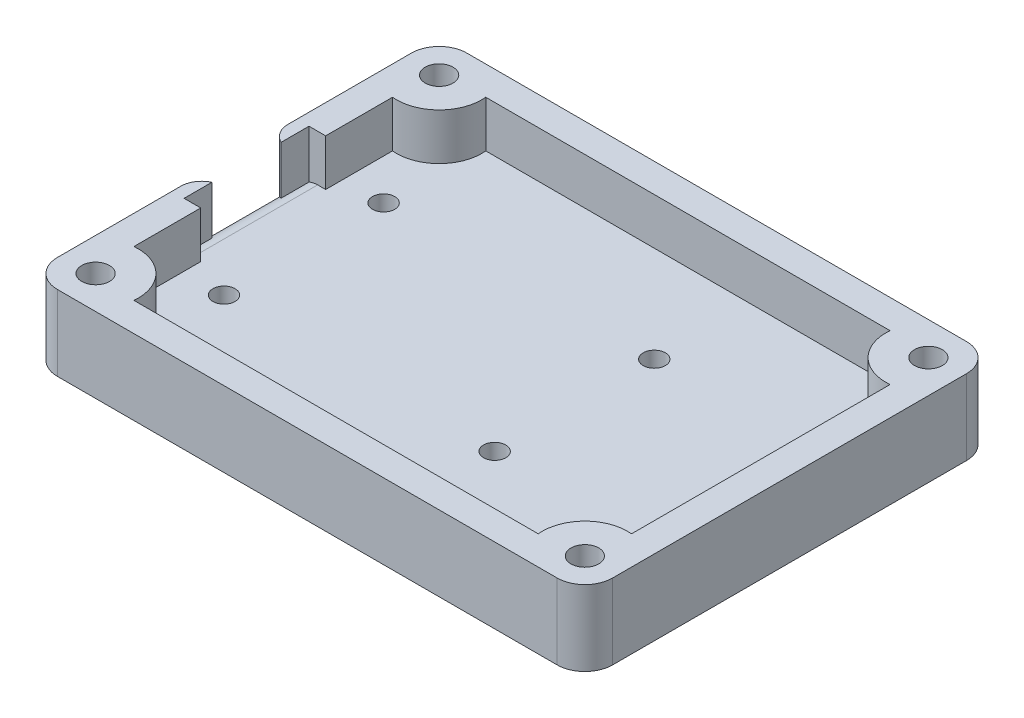
from build123d import *

# Parameters (mm, degrees)
SKETCH1_W           = 80
SKETCH1_H           = 59
BOSS_EXTRUDE1_DEPTH = 10.85
SKETCH2_R           = 2
CUT_EXTRUDE1_DEPTH  = 8.85
SHELL3_START        = 4.15
SHELL3_DEPTH        = 6.7
SKETCH3_R           = 1.6
CUT_EXTRUDE2_DEPTH  = 8.85
SKETCH4_W           = 10
SKETCH4_H           = 6.7
CUT_EXTRUDE3_DEPTH  = 8.85
SKETCH5_W           = 2.4
SKETCH5_H           = 18
CUT_EXTRUDE4_DEPTH  = 6.7
FILLET1_R           = 4
FILLET2_R           = 3


# Read off the part's stored shape, not the designer's step: Shell3
with BuildPart() as part:
    # Sketch1 → Boss-Extrude1 (new body)
    with BuildSketch(Plane(origin=(0, 0, 0), x_dir=(1, 0, 0), z_dir=(0, 1, 0))):
        Rectangle(SKETCH1_W, SKETCH1_H)
    extrude(amount=BOSS_EXTRUDE1_DEPTH)

    # Sketch2 → Cut-Extrude1 (cut)
    with BuildSketch(Plane(origin=(0, 10.85, 0), x_dir=(1, 0, 0), z_dir=(0, 1, 0))):
        with Locations(Location((-35.25, 24.75, 0), (0, 0, 270))):
            Circle(SKETCH2_R)
        with Locations(Location((-35.25, -24.75, 0), (0, 0, 270))):
            Circle(SKETCH2_R)
        with Locations(Location((35.25, 24.75, 0), (0, 0, 270))):
            Circle(SKETCH2_R)
        with Locations(Location((35.25, -24.75, 0), (0, 0, 270))):
            Circle(SKETCH2_R)
    extrude(amount=-CUT_EXTRUDE1_DEPTH, mode=Mode.SUBTRACT)

    # Shell3 outline → Shell3 (cut)
    with BuildSketch(Plane(origin=(0, 0, 0), x_dir=(1, 0, 0), z_dir=(0, 1, 0)).offset(SHELL3_START)):
        with BuildLine():
            ThreePointArc((-35.85, -18.629338271), (-30.901293296, -20.401293296), (-29.129338271, -25.35))
            Line((-29.129338271, -25.35), (29.129338271, -25.35))
            ThreePointArc((29.129338271, -25.35), (30.901293296, -20.401293296), (35.85, -18.629338271))
            Line((35.85, -18.629338271), (35.85, 18.629338271))
            ThreePointArc((35.85, 18.629338271), (30.901293296, 20.401293296), (29.129338271, 25.35))
            Line((29.129338271, 25.35), (-29.129338271, 25.35))
            ThreePointArc((-29.129338271, 25.35), (-30.901293296, 20.401293296), (-35.85, 18.629338271))
            Line((-35.85, 18.629338271), (-35.85, -18.629338271))
        make_face()
    extrude(amount=SHELL3_DEPTH, mode=Mode.SUBTRACT)

    # Sketch3 → Cut-Extrude2 (cut)
    with BuildSketch(Plane(origin=(0, 4.15, 0), x_dir=(1, 0, 0), z_dir=(0, 1, 0))):
        with Locations(Location((-30, -11.5, 0), (0, 0, 270))):
            Circle(SKETCH3_R)
        with Locations(Location((9, -11.5, 0), (0, 0, 270))):
            Circle(SKETCH3_R)
        with Locations(Location((9, 11.5, 0), (0, 0, 270))):
            Circle(SKETCH3_R)
        with Locations(Location((-30, 11.5, 0), (0, 0, 270))):
            Circle(SKETCH3_R)
    extrude(amount=-CUT_EXTRUDE2_DEPTH, mode=Mode.SUBTRACT)

    # Sketch4 → Cut-Extrude3 (cut)
    with BuildSketch(Plane.ZY.offset(40)):
        with Locations((0, 7.5)):
            Rectangle(SKETCH4_W, SKETCH4_H)
    extrude(amount=-CUT_EXTRUDE3_DEPTH, mode=Mode.SUBTRACT)

    # Sketch5 → Cut-Extrude4 (cut)
    with BuildSketch(Plane(origin=(0, 10.85, 0), x_dir=(1, 0, 0), z_dir=(0, 1, 0))):
        with Locations((-37.05, 0)):
            Rectangle(SKETCH5_W, SKETCH5_H)
    extrude(amount=-CUT_EXTRUDE4_DEPTH, mode=Mode.SUBTRACT)

    # Fillet1
    fillet1_edges = [part.edges().sort_by_distance(p)[0] for p in [
        (40, 5.425, 29.5),
        (-40, 5.425, 29.5),
        (-40, 5.425, -29.5),
        (40, 5.425, -29.5),
    ]]
    fillet(fillet1_edges, radius=FILLET1_R)

    # Fillet2
    # the kernel refuses this fillet: 3 mm, written as the material it takes off along each edge
    with BuildSketch(Plane(origin=(-40, 17.667945072, -5), x_dir=(0, 0, -1), z_dir=(0, -1, 0)), Plane(origin=(-40, 4.15, 5), x_dir=(0, 0, 1), z_dir=(0, 1, 0))) as fillet2_piece_1:
        with BuildLine():
            CenterArc((2.727178029, 3), FILLET2_R, 204.624318352, 65.375681648)
            Line((0, 1.75), (-0.054543561, 1.725))
            ThreePointArc((-0.054543561, 1.725), (-0.06, 0.875), (-0.06, 0))
            Line((-0.06, 0), (0, -0.06))
            Line((0, -0.06), (2.727178029, -0.06))
            Line((2.727178029, -0.06), (2.727178029, 0))
        make_face()
    extrude(amount=13.517945072, mode=Mode.SUBTRACT)
    with BuildSketch(Plane(origin=(-40, 4.15, -12.5), x_dir=(0, -1, 0), z_dir=(0, 0, 1))) as fillet2_piece_2_section:
        with BuildLine():
            CenterArc((FILLET2_R, FILLET2_R), FILLET2_R, 180, 90)
            Line((0, FILLET2_R), (-FILLET2_R * 0.02, FILLET2_R))
            Line((-FILLET2_R * 0.02, FILLET2_R), (-FILLET2_R * 0.02, -FILLET2_R * 0.02))
            Line((-FILLET2_R * 0.02, -FILLET2_R * 0.02), (FILLET2_R, -FILLET2_R * 0.02))
            Line((FILLET2_R, -FILLET2_R * 0.02), (FILLET2_R, 0))
        make_face()
    fillet2_piece_2 = extrude(amount=17.5, mode=Mode.PRIVATE)
    fillet2_piece_2 = split(fillet2_piece_2, bisect_by=Plane(origin=(-37.813587666, 4.113532684, -5), z_dir=(0, 0, -1)), keep=Keep.TOP, mode=Mode.PRIVATE)
    fillet2_piece_2 = split(fillet2_piece_2, bisect_by=Plane(origin=(-38.25, 4.113532684, -7), z_dir=(1, 0, 0)), keep=Keep.TOP, mode=Mode.PRIVATE)
    fillet2_piece_2 = split(fillet2_piece_2, bisect_by=Plane(origin=(-37.813587666, 4.113532684, -9), z_dir=(0, 0, 1)), keep=Keep.TOP, mode=Mode.PRIVATE)
    add(fillet2_piece_2, mode=Mode.SUBTRACT)
    with BuildSketch(Plane(origin=(-40, 4.15, -5), x_dir=(0, -1, 0), z_dir=(0, 0, 1))) as fillet2_piece_3_section:
        with BuildLine():
            CenterArc((FILLET2_R, FILLET2_R), FILLET2_R, 180, 90)
            Line((0, FILLET2_R), (-FILLET2_R * 0.02, FILLET2_R))
            Line((-FILLET2_R * 0.02, FILLET2_R), (-FILLET2_R * 0.02, -FILLET2_R * 0.02))
            Line((-FILLET2_R * 0.02, -FILLET2_R * 0.02), (FILLET2_R, -FILLET2_R * 0.02))
            Line((FILLET2_R, -FILLET2_R * 0.02), (FILLET2_R, 0))
        make_face()
    fillet2_piece_3 = extrude(amount=10, mode=Mode.PRIVATE)
    fillet2_piece_3 = split(fillet2_piece_3, bisect_by=Plane(origin=(-38.25, 3.413957666, 0), z_dir=(-1, 0, 0)), keep=Keep.TOP, mode=Mode.PRIVATE)
    add(fillet2_piece_3, mode=Mode.SUBTRACT)
    with BuildSketch(Plane(origin=(-40, 4.15, -5), x_dir=(0, -1, 0), z_dir=(0, 0, 1))) as fillet2_piece_4_section:
        with BuildLine():
            CenterArc((FILLET2_R, FILLET2_R), FILLET2_R, 180, 90)
            Line((0, FILLET2_R), (-FILLET2_R * 0.02, FILLET2_R))
            Line((-FILLET2_R * 0.02, FILLET2_R), (-FILLET2_R * 0.02, -FILLET2_R * 0.02))
            Line((-FILLET2_R * 0.02, -FILLET2_R * 0.02), (FILLET2_R, -FILLET2_R * 0.02))
            Line((FILLET2_R, -FILLET2_R * 0.02), (FILLET2_R, 0))
        make_face()
    fillet2_piece_4 = extrude(amount=10, mode=Mode.PRIVATE)
    fillet2_piece_4 = split(fillet2_piece_4, bisect_by=Plane(origin=(-38.25, 4.113532684, 0), z_dir=(1, 0, 0)), keep=Keep.TOP, mode=Mode.PRIVATE)
    add(fillet2_piece_4, mode=Mode.SUBTRACT)
    with BuildSketch(Plane(origin=(-40, 4.15, -5), x_dir=(0, -1, 0), z_dir=(0, 0, 1))) as fillet2_piece_5_section:
        with BuildLine():
            CenterArc((FILLET2_R, FILLET2_R), FILLET2_R, 180, 90)
            Line((0, FILLET2_R), (-FILLET2_R * 0.02, FILLET2_R))
            Line((-FILLET2_R * 0.02, FILLET2_R), (-FILLET2_R * 0.02, -FILLET2_R * 0.02))
            Line((-FILLET2_R * 0.02, -FILLET2_R * 0.02), (FILLET2_R, -FILLET2_R * 0.02))
            Line((FILLET2_R, -FILLET2_R * 0.02), (FILLET2_R, 0))
        make_face()
    fillet2_piece_5 = extrude(amount=17.5, mode=Mode.PRIVATE)
    fillet2_piece_5 = split(fillet2_piece_5, bisect_by=Plane(origin=(-38.25, 4.113532684, 7), z_dir=(1, 0, 0)), keep=Keep.TOP, mode=Mode.PRIVATE)
    fillet2_piece_5 = split(fillet2_piece_5, bisect_by=Plane(origin=(-37.813587666, 4.113532684, 5), z_dir=(0, 0, 1)), keep=Keep.TOP, mode=Mode.PRIVATE)
    fillet2_piece_5 = split(fillet2_piece_5, bisect_by=Plane(origin=(-37.813587666, 4.113532684, 9), z_dir=(0, 0, -1)), keep=Keep.TOP, mode=Mode.PRIVATE)
    add(fillet2_piece_5, mode=Mode.SUBTRACT)
    with BuildSketch(Plane(origin=(-40, 17.667945072, -5), x_dir=(0, 0, -1), z_dir=(0, -1, 0))) as fillet2_piece_6a_section:
        with BuildLine():
            CenterArc((2.727178029, 3), FILLET2_R, 204.624318352, 65.375681648)
            Line((0, 1.75), (-0.054543561, 1.725))
            ThreePointArc((-0.054543561, 1.725), (-0.06, 0.875), (-0.06, 0))
            Line((-0.06, 0), (0, -0.06))
            Line((0, -0.06), (2.727178029, -0.06))
            Line((2.727178029, -0.06), (2.727178029, 0))
        make_face()
    fillet2_piece_6a = extrude(amount=20.335890143, mode=Mode.PRIVATE)
    fillet2_piece_6a = split(fillet2_piece_6a, bisect_by=Plane(origin=(-39.546962739, 4.15, -5.666780032), z_dir=(0, -1, 0)), keep=Keep.TOP, mode=Mode.PRIVATE)
    with BuildSketch(Plane(origin=(-40, 4.15, -12.5), x_dir=(0, -1, 0), z_dir=(0, 0, 1))) as fillet2_piece_6b_section:
        with BuildLine():
            CenterArc((FILLET2_R, FILLET2_R), FILLET2_R, 180, 90)
            Line((0, FILLET2_R), (-FILLET2_R * 0.02, FILLET2_R))
            Line((-FILLET2_R * 0.02, FILLET2_R), (-FILLET2_R * 0.02, -FILLET2_R * 0.02))
            Line((-FILLET2_R * 0.02, -FILLET2_R * 0.02), (FILLET2_R, -FILLET2_R * 0.02))
            Line((FILLET2_R, -FILLET2_R * 0.02), (FILLET2_R, 0))
        make_face()
    fillet2_piece_6b = extrude(amount=17.5, mode=Mode.PRIVATE)
    fillet2_piece_6b = split(fillet2_piece_6b, bisect_by=Plane(origin=(-39.454149009, 3.413957666, -5), z_dir=(0, 0, -1)), keep=Keep.TOP, mode=Mode.PRIVATE)
    fillet2_piece_6b = split(fillet2_piece_6b, bisect_by=Plane(origin=(-38.25, 3.413957666, -7), z_dir=(-1, 0, 0)), keep=Keep.TOP, mode=Mode.PRIVATE)
    fillet2_piece_6b = split(fillet2_piece_6b, bisect_by=Plane(origin=(-39.454149009, 3.413957666, -9), z_dir=(0, 0, 1)), keep=Keep.TOP, mode=Mode.PRIVATE)
    fillet2_piece_6 = fillet2_piece_6a & fillet2_piece_6b
    add(fillet2_piece_6, mode=Mode.SUBTRACT)
    with BuildSketch(Plane(origin=(-40, -2.667945072, 5), x_dir=(0, 0, 1), z_dir=(0, 1, 0))) as fillet2_piece_7a_section:
        with BuildLine():
            CenterArc((2.727178029, 3), FILLET2_R, 204.624318352, 65.375681648)
            Line((0, 1.75), (-0.054543561, 1.725))
            ThreePointArc((-0.054543561, 1.725), (-0.06, 0.875), (-0.06, 0))
            Line((-0.06, 0), (0, -0.06))
            Line((0, -0.06), (2.727178029, -0.06))
            Line((2.727178029, -0.06), (2.727178029, 0))
        make_face()
    fillet2_piece_7a = extrude(amount=20.335890143, mode=Mode.PRIVATE)
    fillet2_piece_7a = split(fillet2_piece_7a, bisect_by=Plane(origin=(-39.546962739, 4.15, 5.666780032), z_dir=(0, -1, 0)), keep=Keep.TOP, mode=Mode.PRIVATE)
    with BuildSketch(Plane(origin=(-40, 4.15, -5), x_dir=(0, -1, 0), z_dir=(0, 0, 1))) as fillet2_piece_7b_section:
        with BuildLine():
            CenterArc((FILLET2_R, FILLET2_R), FILLET2_R, 180, 90)
            Line((0, FILLET2_R), (-FILLET2_R * 0.02, FILLET2_R))
            Line((-FILLET2_R * 0.02, FILLET2_R), (-FILLET2_R * 0.02, -FILLET2_R * 0.02))
            Line((-FILLET2_R * 0.02, -FILLET2_R * 0.02), (FILLET2_R, -FILLET2_R * 0.02))
            Line((FILLET2_R, -FILLET2_R * 0.02), (FILLET2_R, 0))
        make_face()
    fillet2_piece_7b = extrude(amount=17.5, mode=Mode.PRIVATE)
    fillet2_piece_7b = split(fillet2_piece_7b, bisect_by=Plane(origin=(-38.25, 3.413957666, 7), z_dir=(-1, 0, 0)), keep=Keep.TOP, mode=Mode.PRIVATE)
    fillet2_piece_7b = split(fillet2_piece_7b, bisect_by=Plane(origin=(-39.454149009, 3.413957666, 5), z_dir=(0, 0, 1)), keep=Keep.TOP, mode=Mode.PRIVATE)
    fillet2_piece_7b = split(fillet2_piece_7b, bisect_by=Plane(origin=(-39.454149009, 3.413957666, 9), z_dir=(0, 0, -1)), keep=Keep.TOP, mode=Mode.PRIVATE)
    fillet2_piece_7 = fillet2_piece_7a & fillet2_piece_7b
    add(fillet2_piece_7, mode=Mode.SUBTRACT)


solid = part.part
